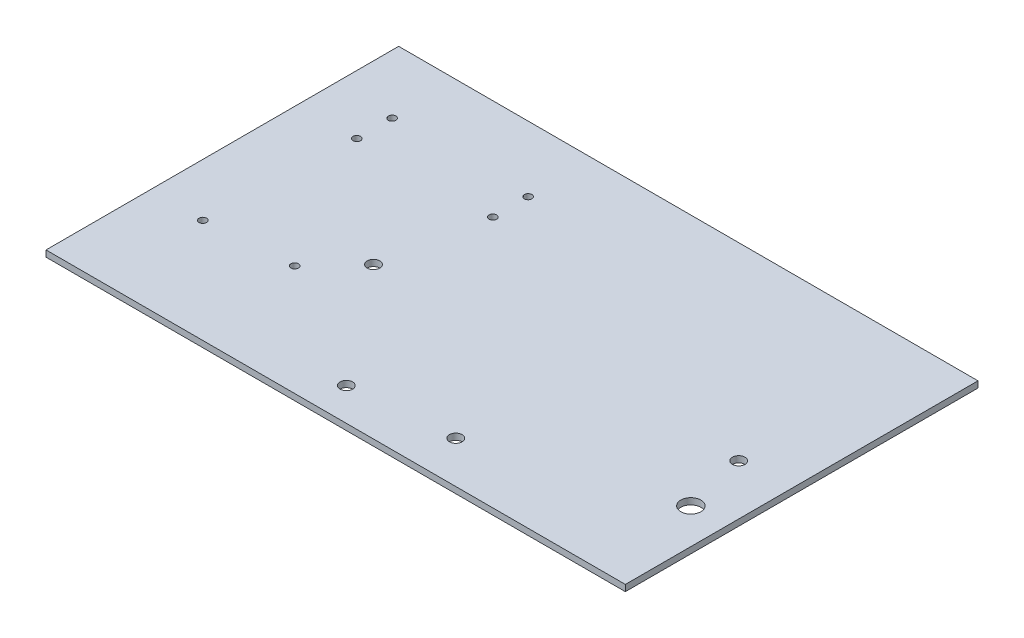
from build123d import *

# Parameters (mm, degrees)
SKETCH1_W           = 317.5
SKETCH1_H           = 177.8
SKETCH1_R           = 3.175
SKETCH1_R_2         = 1.905
BOSS_EXTRUDE1_DEPTH = 3.175
SKETCH2_R           = 1.905
CUT_EXTRUDE1_DEPTH  = 182.974869488
SKETCH3_R           = 3.175
CUT_EXTRUDE2_DEPTH  = 182.974869488
SKETCH4_W           = 25.4
SKETCH4_H           = 177.8
CUT_EXTRUDE3_DEPTH  = 182.974869488
SKETCH5_R           = 5.08
CUT_EXTRUDE4_DEPTH  = 182.974869488


with BuildPart() as part:
    # Sketch1 → Boss-Extrude1 (new body)
    with BuildSketch(Plane(origin=(0, 0, 0), x_dir=(1, 0, 0), z_dir=(0, 1, 0))):
        Rectangle(SKETCH1_W, SKETCH1_H)
        with Locations((-69.85, -12.7)):
            Circle(SKETCH1_R, mode=Mode.SUBTRACT)
        with Locations((107.95, -6.35)):
            Circle(SKETCH1_R, mode=Mode.SUBTRACT)
        with Locations((-129.032, 55.88)):
            Circle(SKETCH1_R_2, mode=Mode.SUBTRACT)
        with Locations((-60.452, 55.88)):
            Circle(SKETCH1_R_2, mode=Mode.SUBTRACT)
        with Locations((-129.032, 38.1)):
            Circle(SKETCH1_R_2, mode=Mode.SUBTRACT)
        with Locations((-60.452, 38.1)):
            Circle(SKETCH1_R_2, mode=Mode.SUBTRACT)
    extrude(amount=BOSS_EXTRUDE1_DEPTH)

    # Sketch2 → Cut-Extrude1 (cut, through all)
    with BuildSketch(Plane(origin=(0, 3.175, 0), x_dir=(1, 0, 0), z_dir=(0, 1, 0))):
        with Locations((-89.08170041, -33.177029855)):
            Circle(SKETCH2_R)
        with Locations((-132.137607944, -36.44830276)):
            Circle(SKETCH2_R)
    extrude(amount=-CUT_EXTRUDE1_DEPTH, mode=Mode.SUBTRACT)

    # Sketch3 → Cut-Extrude2 (cut, through all)
    with BuildSketch(Plane(origin=(0, 0, 0), x_dir=(-1, 0, 0), z_dir=(0, -1, 0))):
        with Locations((23.829539609, -72.39)):
            Circle(SKETCH3_R)
        with Locations((-26.764302072, -67.818)):
            Circle(SKETCH3_R)
    extrude(amount=-CUT_EXTRUDE2_DEPTH, mode=Mode.SUBTRACT)

    # Sketch4 → Cut-Extrude3 (cut, through all)
    with BuildSketch(Plane(origin=(0, 3.175, 0), x_dir=(1, 0, 0), z_dir=(0, 1, 0))):
        with Locations((146.05, 0)):
            Rectangle(SKETCH4_W, SKETCH4_H)
    extrude(amount=-CUT_EXTRUDE3_DEPTH, mode=Mode.SUBTRACT)

    # Sketch5 → Cut-Extrude4 (cut, through all)
    with BuildSketch(Plane(origin=(0, 3.175, 0), x_dir=(1, 0, 0), z_dir=(0, 1, 0))):
        with Locations((115.57, -38.1)):
            Circle(SKETCH5_R)
    extrude(amount=-CUT_EXTRUDE4_DEPTH, mode=Mode.SUBTRACT)


solid = part.part
